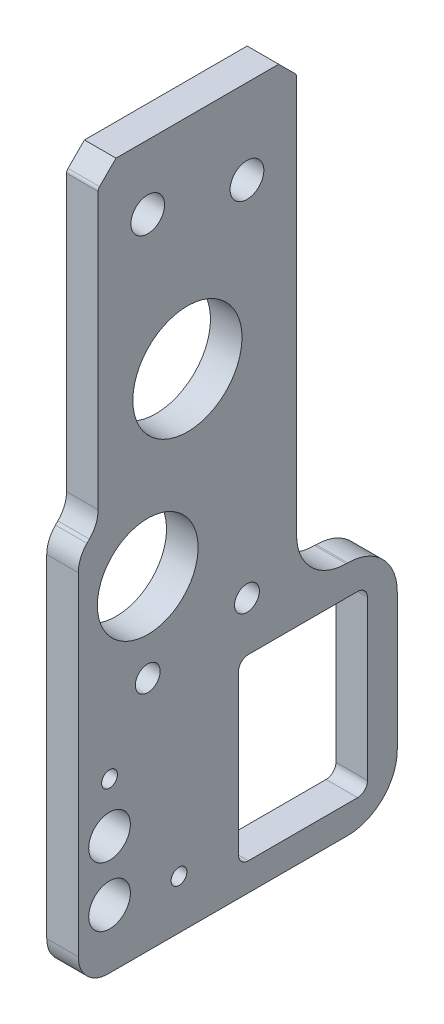
from build123d import *

# Parameters (mm, degrees)
SKETCH1_R             = 5.075
SKETCH1_R_2           = 1.7
SKETCH1_R_3           = 2.1
SKETCH1_R_4           = 0.8
SKETCH1_W             = 13
SKETCH1_H             = 18
BOSS_EXTRUDE1_DEPTH   = 3.18
SKETCH3_R             = 5.5
CUT_EXTRUDE4_DEPTH    = 78.831812262
FILLET2_R             = 3
CHAMFER2_SIZE         = 1.8
FILLET4_R             = 0.5
M2X0_4_TAPPED_HOLE1_D = 1.6
FILLET9_R             = 1
FILLET11_R            = 5
M3X0_5_TAPPED_HOLE1_D = 2.5


with BuildPart() as part:
    # Sketch1 → Boss-Extrude1 (new body)
    with BuildSketch(Plane(origin=(0, 0, 0), x_dir=(0, 0, -1), z_dir=(1, 0, 0))):
        Polygon((0, 0), (0, 37.775), (2, 39.775), (2, 70.81), (22, 70.81), (22, 23.81), (32.15, 23.81), (32.15, 0), align=None)
        with Locations((7, 32.7)):
            Circle(SKETCH1_R, mode=Mode.SUBTRACT)
        with Locations((7, 64.31)):
            Circle(SKETCH1_R_2, mode=Mode.SUBTRACT)
        with Locations((17, 62.31)):
            Circle(SKETCH1_R_2, mode=Mode.SUBTRACT)
        with Locations((3.15, 5.95)):
            Circle(SKETCH1_R_3, mode=Mode.SUBTRACT)
        with Locations((3.15, 11.95)):
            Circle(SKETCH1_R_3, mode=Mode.SUBTRACT)
        with Locations((10.15, 4.95)):
            Circle(SKETCH1_R_4, mode=Mode.SUBTRACT)
        with Locations((3.15, 16.95)):
            Circle(SKETCH1_R_4, mode=Mode.SUBTRACT)
        with Locations((22.65, 11.81)):
            Rectangle(SKETCH1_W, SKETCH1_H, mode=Mode.SUBTRACT)
    extrude(amount=BOSS_EXTRUDE1_DEPTH)

    # Sketch3 → Cut-Extrude4 (cut, through all)
    with BuildSketch(Plane.ZY):
        with Locations((-11, 48.810865899)):
            Circle(SKETCH3_R)
    extrude(amount=-CUT_EXTRUDE4_DEPTH, mode=Mode.SUBTRACT)

    # Fillet2
    fillet2_edges = [part.edges().sort_by_distance(p)[0] for p in [
        (1.59, 37.775, 0),
        (1.59, 39.775, -2),
        (1.59, 0, 0),
    ]]
    fillet(fillet2_edges, radius=FILLET2_R)

    # Chamfer2
    chamfer2_edges = [part.edges().sort_by_distance(p)[0] for p in [
        (1.59, 70.81, -22),
        (1.59, 70.81, -2),
    ]]
    chamfer(chamfer2_edges, length=CHAMFER2_SIZE)

    # Fillet4
    fillet4_edges = [part.edges().sort_by_distance(p)[0] for p in [
        (1.59, 69.01, -2),
        (1.59, 69.01, -22),
    ]]
    fillet(fillet4_edges, radius=FILLET4_R)

    # M2x0.4 Tapped Hole1 (through all)
    with Locations(Plane(origin=(0, 16.95, -3.15), x_dir=(0, 0, -1), z_dir=(-1, 0, 0))):
        with Locations((0, 0), (7, 12)):
            Hole(M2X0_4_TAPPED_HOLE1_D / 2)

    # Fillet9
    fillet9_edges = [part.edges().sort_by_distance(p)[0] for p in [
        (1.59, 2.81, -29.15),
        (1.59, 2.81, -16.15),
        (1.59, 20.81, -29.15),
        (1.59, 20.81, -16.15),
    ]]
    fillet(fillet9_edges, radius=FILLET9_R)

    # Fillet11
    fillet11_edges = [part.edges().sort_by_distance(p)[0] for p in [
        (1.59, 0, -32.15),
        (1.59, 23.81, -22),
        (1.59, 23.81, -32.15),
    ]]
    fillet(fillet11_edges, radius=FILLET11_R)

    # M3x0.5 Tapped Hole1 (through all)
    with Locations(Plane(origin=(3.18, 0, 0), x_dir=(0, 0, -1), z_dir=(1, 0, 0))):
        with Locations((7, 23.81), (17, 25.81)):
            Hole(M3X0_5_TAPPED_HOLE1_D / 2)


solid = part.part
